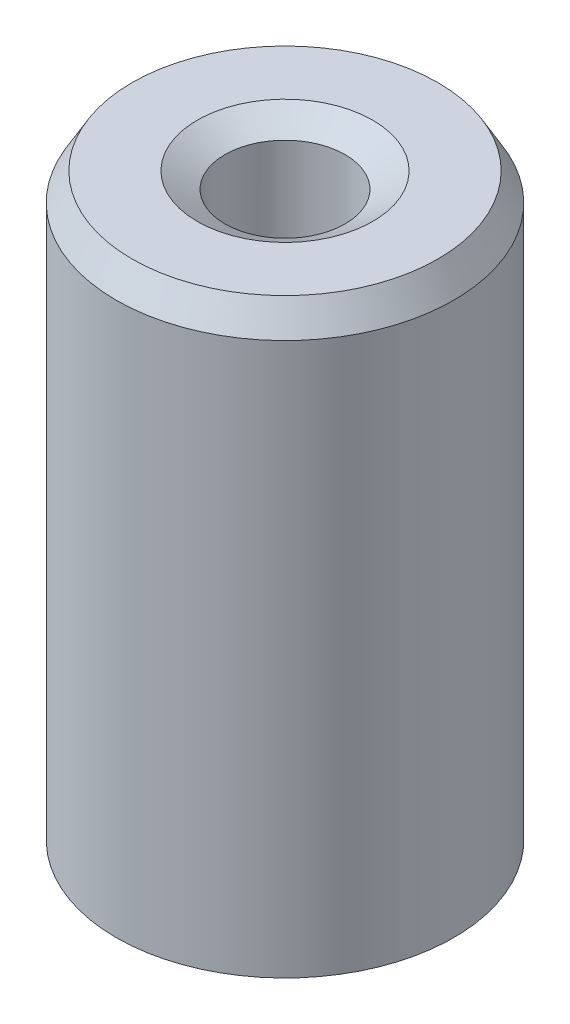
from build123d import *
from OCP.BRepFilletAPI import BRepFilletAPI_MakeChamfer

# Parameters (mm, degrees)
SKETCH1_R           = 7.5
BOSS_EXTRUDE1_DEPTH = 26.462460695
SKETCH2_R           = 2.669376412
CUT_EXTRUDE1_DEPTH  = 29.50897799
CHAMFER1_SIZE       = 1.228787552
CHAMFER1_SIZE2      = 0.709440824


with BuildPart() as part:
    # Sketch1 → Boss-Extrude1 (new body)
    with BuildSketch(Plane(origin=(0, 0, 0), x_dir=(1, 0, 0), z_dir=(0, 1, 0))):
        Circle(SKETCH1_R)
    extrude(amount=BOSS_EXTRUDE1_DEPTH)

    # Sketch2 → Cut-Extrude1 (cut, through all)
    with BuildSketch(Plane(origin=(0, 0, 0), x_dir=(1, 0, 0), z_dir=(0, 1, 0))):
        Circle(SKETCH2_R)
    extrude(amount=CUT_EXTRUDE1_DEPTH, mode=Mode.SUBTRACT)

    # Chamfer1: one chamfer whose edges measure the first distance from different faces: ONE call of the kernel's chamfer builder (chamfer() names one face for all edges)
    chamfer1_edges_1 = [part.edges().sort_by_distance(p)[0] for p in [
        (-2.669376412, 26.462460695, 0),
    ]]
    chamfer1_side_1 = [part.faces().sort_by_distance(p)[0] for p in [
        (-7.287867966, 26.462460695, 0),
    ]]
    chamfer1_edges_2 = [part.edges().sort_by_distance(p)[0] for p in [
        (-2.669376412, 0, 0),
    ]]
    chamfer1_side_2 = [part.faces().sort_by_distance(p)[0] for p in [
        (-2.669376412, 13.231230347, 0),
    ]]
    chamfer1_edges_3 = [part.edges().sort_by_distance(p)[0] for p in [
        (-7.5, 0, 0),
    ]]
    chamfer1_side_3 = [part.faces().sort_by_distance(p)[0] for p in [
        (-7.287867966, 0, 0),
    ]]
    chamfer1_edges_4 = [part.edges().sort_by_distance(p)[0] for p in [
        (-7.5, 26.462460695, 0),
    ]]
    chamfer1_side_4 = [part.faces().sort_by_distance(p)[0] for p in [
        (-7.5, 13.231230347, 0),
    ]]
    chamfer1 = BRepFilletAPI_MakeChamfer(part.part.solid().wrapped)
    for e in chamfer1_edges_1:
        chamfer1.Add(CHAMFER1_SIZE, CHAMFER1_SIZE2, e.wrapped, chamfer1_side_1[0].wrapped)  # the first distance lies on this face
    for e in chamfer1_edges_2:
        chamfer1.Add(CHAMFER1_SIZE, CHAMFER1_SIZE2, e.wrapped, chamfer1_side_2[0].wrapped)  # the first distance lies on this face
    for e in chamfer1_edges_3:
        chamfer1.Add(CHAMFER1_SIZE, CHAMFER1_SIZE2, e.wrapped, chamfer1_side_3[0].wrapped)  # the first distance lies on this face
    for e in chamfer1_edges_4:
        chamfer1.Add(CHAMFER1_SIZE, CHAMFER1_SIZE2, e.wrapped, chamfer1_side_4[0].wrapped)  # the first distance lies on this face
    add(Compound.cast(chamfer1.Shape()), mode=Mode.REPLACE)


solid = part.part
